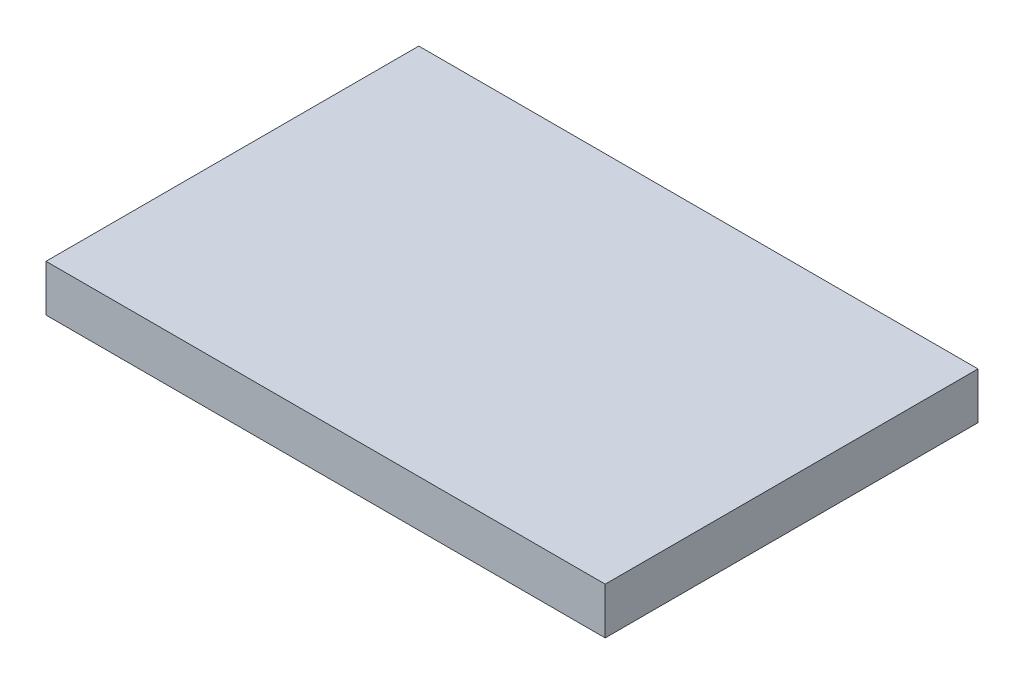
from build123d import *

# Parameters (mm, degrees)
SKETCH1_W           = 120
SKETCH1_H           = 80
BOSS_EXTRUDE1_DEPTH = 10


with BuildPart() as part:
    # Sketch1 → Boss-Extrude1 (new body)
    with BuildSketch(Plane.XZ.offset(-4470)):
        with Locations((-26.489460092, -13.07873573)):
            Rectangle(SKETCH1_W, SKETCH1_H)
    extrude(amount=BOSS_EXTRUDE1_DEPTH)


solid = part.part
